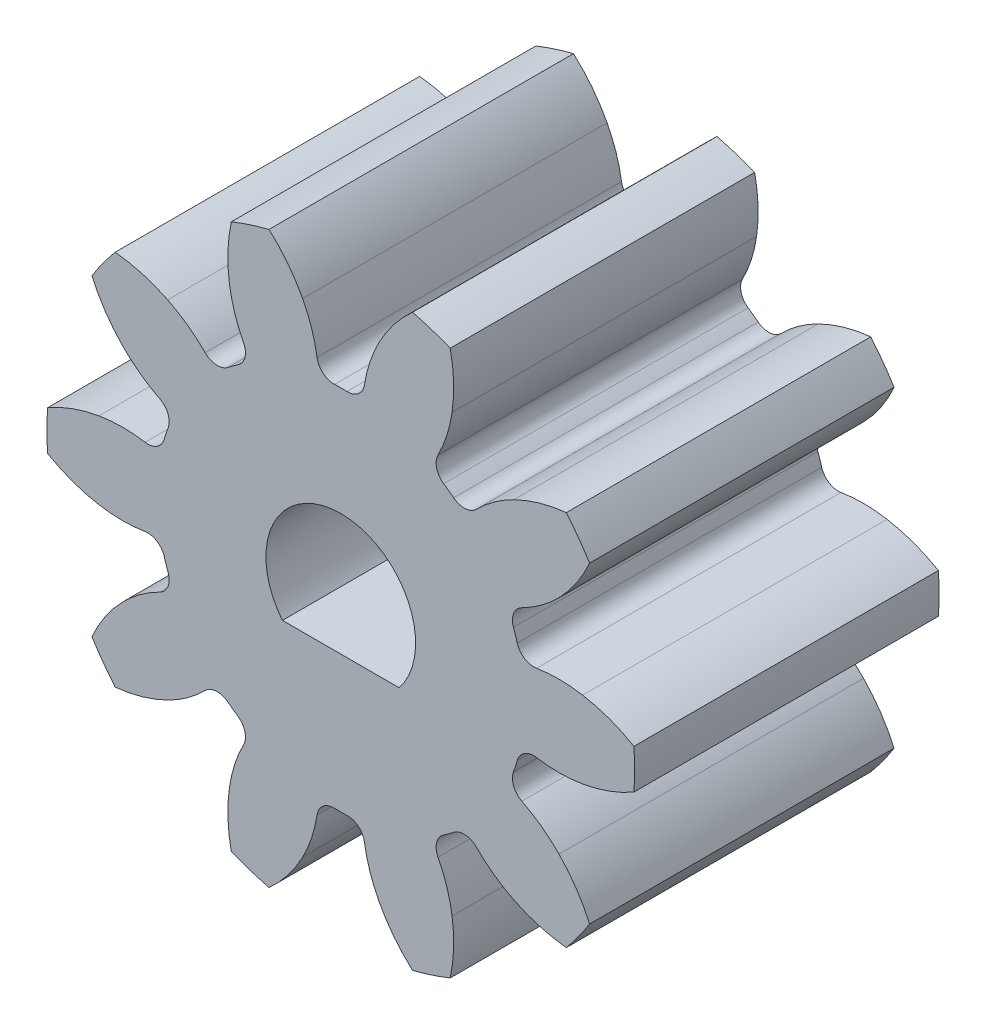
from build123d import *

# Parameters (mm, degrees)
SKETCH1_R                = 5.887500036
BLANK_DISK_DEPTH         = 3.05
GEAR_TOOTH_CUT_DEPTH     = 11.321594513
GEAR_START               = -3.049999996
GEAR_TEETH_REVOLVE_DEPTH = 6.099999992
HUB_EXTRUDE_DEPTH        = 11.221001367


# Read off the part's stored shape, not the designer's step: GEAR TEETH REVOLVE
with BuildPart() as part:
    # Sketch1 → BLANK DISK (new, symmetric)
    with BuildSketch(Plane.XY):
        with Locations(Location((0, 0, 0), (0, 0, 180))):
            Circle(SKETCH1_R)
    extrude(amount=BLANK_DISK_DEPTH, both=True)

    # Sketch2 → GEAR TOOTH CUT (cut, through all)
    with BuildSketch(Plane.XY.offset(3.049999996)):
        with BuildLine():
            ThreePointArc((-4.985659759, -3.131429935), (-5.599345274, -1.819337566), (-5.874091808, -0.397117245))
            ThreePointArc((-5.874091808, -0.397117245), (-5.376423722, -0.629962338), (-4.845327653, -0.77077188))
            ThreePointArc((-4.845327653, -0.77077188), (-4.383437981, -0.811075473), (-3.921230969, -0.774590865))
            ThreePointArc((-3.921230969, -0.774590865), (-3.682257583, -0.823363871), (-3.535926696, -1.018490385))
            ThreePointArc((-3.535926696, -1.018490385), (-3.499590796, -1.137085978), (-3.459278416, -1.254389535))
            ThreePointArc((-3.459278416, -1.254389535), (-3.462970103, -1.498261339), (-3.627635579, -1.678184561))
            ThreePointArc((-3.627635579, -1.678184561), (-4.023014022, -1.920346358), (-4.373000758, -2.224444588))
            ThreePointArc((-4.373000758, -2.224444588), (-4.719900732, -2.650532337), (-4.985659759, -3.131429935))
        make_face()
    extrude(amount=-GEAR_TOOTH_CUT_DEPTH, mode=Mode.SUBTRACT)

    # GEAR TEETH REVOLVE outline → GEAR TEETH REVOLVE (cut)
    with BuildSketch(Plane.XY.offset(GEAR_START)):
        with BuildLine():
            ThreePointArc((-4.518820439, -3.773979135), (-3.460585694, -4.763087583), (-2.192875139, -5.463877313))
            ThreePointArc((-2.192875139, -5.463877313), (-2.260536085, -4.918613747), (-2.230336207, -4.369998828))
            ThreePointArc((-2.230336207, -4.369998828), (-2.125935444, -3.918261151), (-1.948406698, -3.489950524))
            ThreePointArc((-1.948406698, -3.489950524), (-1.920945745, -3.247601641), (-2.061303357, -3.048135288))
            ThreePointArc((-2.061303357, -3.048135288), (-2.162866059, -2.97692974), (-2.26197116, -2.902341595))
            ThreePointArc((-2.26197116, -2.902341595), (-2.495047822, -2.830492067), (-2.717049406, -2.931498908))
            ThreePointArc((-2.717049406, -2.931498908), (-3.069537619, -3.232694041), (-3.466904071, -3.471579687))
            ThreePointArc((-3.466904071, -3.471579687), (-3.979335588, -3.669832811), (-4.518820439, -3.773979135))
        make_face()
        with BuildLine():
            ThreePointArc((-1.437513252, -5.709309268), (0, -5.887500035), (1.437513252, -5.709309268))
            ThreePointArc((1.437513252, -5.709309268), (1.062276513, -5.307951883), (0.764240969, -4.846362048))
            ThreePointArc((0.764240969, -4.846362048), (0.583178216, -4.419533361), (0.475047319, -3.968674006))
            ThreePointArc((0.475047319, -3.968674006), (0.354814597, -3.756468498), (0.124019523, -3.677596963))
            ThreePointArc((0.124019523, -3.677596963), (0, -3.679687523), (-0.124019523, -3.677596963))
            ThreePointArc((-0.124019523, -3.677596963), (-0.354814597, -3.756468498), (-0.475047319, -3.968674006))
            ThreePointArc((-0.475047319, -3.968674006), (-0.583178216, -4.419533361), (-0.764240969, -4.846362048))
            ThreePointArc((-0.764240969, -4.846362048), (-1.062276513, -5.307951883), (-1.437513252, -5.709309268))
        make_face()
        with BuildLine():
            ThreePointArc((2.192875139, -5.463877313), (3.460585694, -4.763087583), (4.518820439, -3.773979135))
            ThreePointArc((4.518820439, -3.773979135), (3.979335588, -3.669832811), (3.466904071, -3.471579687))
            ThreePointArc((3.466904071, -3.471579687), (3.069537619, -3.232694041), (2.717049406, -2.931498908))
            ThreePointArc((2.717049406, -2.931498908), (2.495047822, -2.830492067), (2.26197116, -2.902341595))
            ThreePointArc((2.26197116, -2.902341595), (2.162866059, -2.97692974), (2.061303357, -3.048135288))
            ThreePointArc((2.061303357, -3.048135288), (1.920945745, -3.247601641), (1.948406698, -3.489950524))
            ThreePointArc((1.948406698, -3.489950524), (2.125935444, -3.918261151), (2.230336207, -4.369998828))
            ThreePointArc((2.230336207, -4.369998828), (2.260536085, -4.918613747), (2.192875139, -5.463877313))
        make_face()
        with BuildLine():
            ThreePointArc((4.985659759, -3.131429935), (5.599345274, -1.819337565), (5.874091808, -0.397117245))
            ThreePointArc((5.874091808, -0.397117245), (5.376423722, -0.629962338), (4.845327653, -0.77077188))
            ThreePointArc((4.845327653, -0.77077188), (4.383437981, -0.811075473), (3.921230969, -0.774590865))
            ThreePointArc((3.921230969, -0.774590865), (3.682257583, -0.823363871), (3.535926696, -1.018490385))
            ThreePointArc((3.535926696, -1.018490385), (3.499590796, -1.137085978), (3.459278416, -1.254389535))
            ThreePointArc((3.459278416, -1.254389535), (3.462970103, -1.498261338), (3.627635579, -1.678184561))
            ThreePointArc((3.627635579, -1.678184561), (4.023014022, -1.920346358), (4.373000758, -2.224444588))
            ThreePointArc((4.373000758, -2.224444588), (4.719900732, -2.650532336), (4.985659759, -3.131429935))
        make_face()
        with BuildLine():
            ThreePointArc((5.874091808, 0.397117245), (5.599345274, 1.819337566), (4.98565976, 3.131429935))
            ThreePointArc((4.98565976, 3.131429935), (4.719900732, 2.650532336), (4.373000758, 2.224444588))
            ThreePointArc((4.373000758, 2.224444588), (4.023014022, 1.920346358), (3.627635579, 1.678184561))
            ThreePointArc((3.627635579, 1.678184561), (3.462970103, 1.498261338), (3.459278416, 1.254389535))
            ThreePointArc((3.459278416, 1.254389535), (3.499590796, 1.137085978), (3.535926696, 1.018490385))
            ThreePointArc((3.535926696, 1.018490385), (3.682257583, 0.823363871), (3.921230969, 0.774590865))
            ThreePointArc((3.921230969, 0.774590865), (4.383437981, 0.811075473), (4.845327653, 0.77077188))
            ThreePointArc((4.845327653, 0.77077188), (5.376423722, 0.629962338), (5.874091808, 0.397117245))
        make_face()
        with BuildLine():
            ThreePointArc((4.51882044, 3.773979135), (3.460585695, 4.763087584), (2.192875139, 5.463877314))
            ThreePointArc((2.192875139, 5.463877314), (2.260536085, 4.918613747), (2.230336207, 4.369998828))
            ThreePointArc((2.230336207, 4.369998828), (2.125935444, 3.918261151), (1.948406698, 3.489950524))
            ThreePointArc((1.948406698, 3.489950524), (1.920945745, 3.247601641), (2.061303357, 3.048135288))
            ThreePointArc((2.061303357, 3.048135288), (2.162866059, 2.97692974), (2.26197116, 2.902341595))
            ThreePointArc((2.26197116, 2.902341595), (2.495047822, 2.830492067), (2.717049406, 2.931498908))
            ThreePointArc((2.717049406, 2.931498908), (3.069537619, 3.232694041), (3.466904071, 3.471579687))
            ThreePointArc((3.466904071, 3.471579687), (3.979335588, 3.669832811), (4.51882044, 3.773979135))
        make_face()
        with BuildLine():
            ThreePointArc((1.437513252, 5.709309269), (0, 5.887500037), (-1.437513252, 5.709309269))
            ThreePointArc((-1.437513252, 5.709309269), (-1.062276513, 5.307951883), (-0.764240969, 4.846362048))
            ThreePointArc((-0.764240969, 4.846362048), (-0.583178216, 4.419533361), (-0.475047319, 3.968674006))
            ThreePointArc((-0.475047319, 3.968674006), (-0.354814597, 3.756468498), (-0.124019523, 3.677596963))
            ThreePointArc((-0.124019523, 3.677596963), (0, 3.679687523), (0.124019523, 3.677596963))
            ThreePointArc((0.124019523, 3.677596963), (0.354814597, 3.756468498), (0.475047319, 3.968674006))
            ThreePointArc((0.475047319, 3.968674006), (0.583178216, 4.419533361), (0.764240969, 4.846362048))
            ThreePointArc((0.764240969, 4.846362048), (1.062276513, 5.307951883), (1.437513252, 5.709309269))
        make_face()
        with BuildLine():
            ThreePointArc((-2.192875139, 5.463877315), (-3.460585695, 4.763087584), (-4.51882044, 3.773979136))
            ThreePointArc((-4.51882044, 3.773979136), (-3.979335588, 3.669832811), (-3.466904071, 3.471579687))
            ThreePointArc((-3.466904071, 3.471579687), (-3.069537619, 3.232694041), (-2.717049406, 2.931498908))
            ThreePointArc((-2.717049406, 2.931498908), (-2.495047822, 2.830492067), (-2.26197116, 2.902341595))
            ThreePointArc((-2.26197116, 2.902341595), (-2.162866059, 2.97692974), (-2.061303357, 3.048135288))
            ThreePointArc((-2.061303357, 3.048135288), (-1.920945745, 3.247601641), (-1.948406698, 3.489950524))
            ThreePointArc((-1.948406698, 3.489950524), (-2.125935444, 3.918261151), (-2.230336207, 4.369998828))
            ThreePointArc((-2.230336207, 4.369998828), (-2.260536085, 4.918613747), (-2.192875139, 5.463877315))
        make_face()
        with BuildLine():
            ThreePointArc((-3.535926696, 1.018490385), (-3.499590796, 1.137085978), (-3.459278416, 1.254389535))
            ThreePointArc((-3.459278416, 1.254389535), (-3.462970103, 1.498261338), (-3.627635579, 1.678184561))
            ThreePointArc((-3.627635579, 1.678184561), (-4.023014022, 1.920346358), (-4.373000758, 2.224444588))
            ThreePointArc((-4.373000758, 2.224444588), (-4.719900732, 2.650532336), (-4.985659759, 3.131429935))
            ThreePointArc((-4.985659759, 3.131429935), (-5.599345274, 1.819337566), (-5.874091808, 0.397117245))
            ThreePointArc((-5.874091808, 0.397117245), (-5.376423722, 0.629962338), (-4.845327653, 0.77077188))
            ThreePointArc((-4.845327653, 0.77077188), (-4.383437981, 0.811075473), (-3.921230969, 0.774590865))
            ThreePointArc((-3.921230969, 0.774590865), (-3.682257583, 0.823363871), (-3.535926696, 1.018490385))
        make_face()
    extrude(amount=GEAR_TEETH_REVOLVE_DEPTH, mode=Mode.SUBTRACT)

    # Sketch3 → HUB EXTRUDE (cut, through all)
    with BuildSketch(Plane.XY.offset(3.049999996)):
        with BuildLine():
            Line((-1.169092, -0.9398), (1.169092, -0.9398))
            ThreePointArc((1.169092, -0.9398), (0, 1.500000048), (-1.169092, -0.9398))
        make_face()
    extrude(amount=-HUB_EXTRUDE_DEPTH, mode=Mode.SUBTRACT)


solid = part.part
